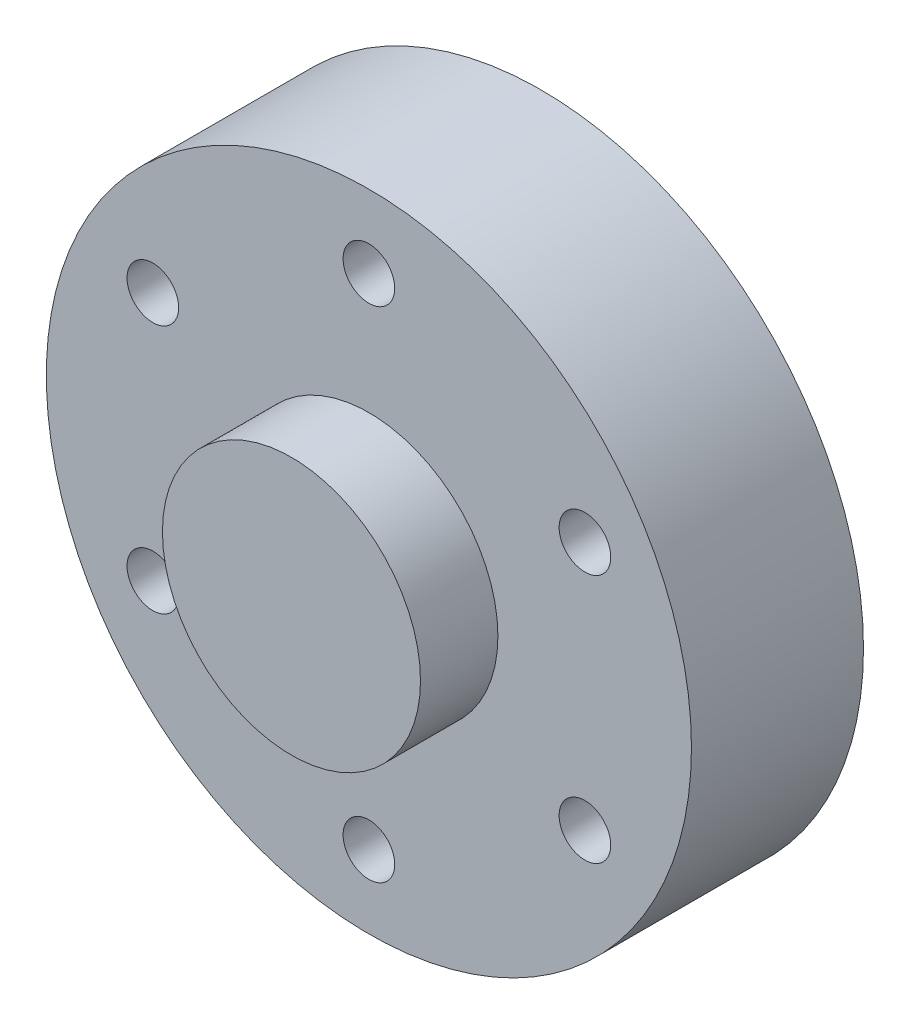
from build123d import *

# Parameters (mm, degrees)
SKETCH2_R           = 18.75
SKETCH2_R_2         = 1.5
BOSS_EXTRUDE1_DEPTH = 10
SKETCH3_R           = 7.5
BOSS_EXTRUDE2_DEPTH = 4.5
BOSS_EXTRUDE4_START = 4.5
SKETCH6_R           = 7.5
BOSS_EXTRUDE4_DEPTH = 4.5
SKETCH7_R           = 2
BOSS_EXTRUDE5_DEPTH = 1
FILLET2_R           = 0.05
CUT_EXTRUDE1_DEPTH  = 11


with BuildPart() as part:
    # Sketch2 → Boss-Extrude1 (new body)
    with BuildSketch(Plane.XY):
        Circle(SKETCH2_R)
        with Locations((0, -14.5)):
            Circle(SKETCH2_R_2, mode=Mode.SUBTRACT)
        with Locations((-12.557368355, -7.25)):
            Circle(SKETCH2_R_2, mode=Mode.SUBTRACT)
        with Locations((12.557368355, -7.25)):
            Circle(SKETCH2_R_2, mode=Mode.SUBTRACT)
        with Locations((-12.557368355, 7.25)):
            Circle(SKETCH2_R_2, mode=Mode.SUBTRACT)
        with Locations((0, 14.5)):
            Circle(SKETCH2_R_2, mode=Mode.SUBTRACT)
        with Locations((12.557368355, 7.25)):
            Circle(SKETCH2_R_2, mode=Mode.SUBTRACT)
    extrude(amount=BOSS_EXTRUDE1_DEPTH)

    # Sketch3 → Boss-Extrude2 (add)
    with BuildSketch(Plane.XY.offset(10)):
        Circle(SKETCH3_R)
    extrude(amount=BOSS_EXTRUDE2_DEPTH)

    # Sketch6 → Boss-Extrude4 (add)
    with BuildSketch(Plane(origin=(0, 0, 0), x_dir=(-1, 0, 0), z_dir=(0, 0, -1)).offset(BOSS_EXTRUDE4_START)):
        Circle(SKETCH6_R)
    extrude(amount=-BOSS_EXTRUDE4_DEPTH)

    # Sketch7 → Boss-Extrude5 (add)
    with BuildSketch(Plane(origin=(0, 0, -4.5), x_dir=(-1, 0, 0), z_dir=(0, 0, -1))):
        Circle(SKETCH7_R)
    extrude(amount=BOSS_EXTRUDE5_DEPTH)

    # Fillet2
    fillet2_edges = [part.edges().sort_by_distance(p)[0] for p in [
        (2, 0, -5.5),
    ]]
    fillet(fillet2_edges, radius=FILLET2_R)

    # Sketch9 → Cut-Extrude1 (cut)
    with BuildSketch(Plane(origin=(0, 0, -5.5), x_dir=(-1, 0, 0), z_dir=(0, 0, -1))):
        with BuildLine():
            Line((-1.118033989, 1), (1.118033989, 1))
            ThreePointArc((1.118033989, 1), (0, -1.5), (-1.118033989, 1))
        make_face()
    extrude(amount=-CUT_EXTRUDE1_DEPTH, mode=Mode.SUBTRACT)


solid = part.part
